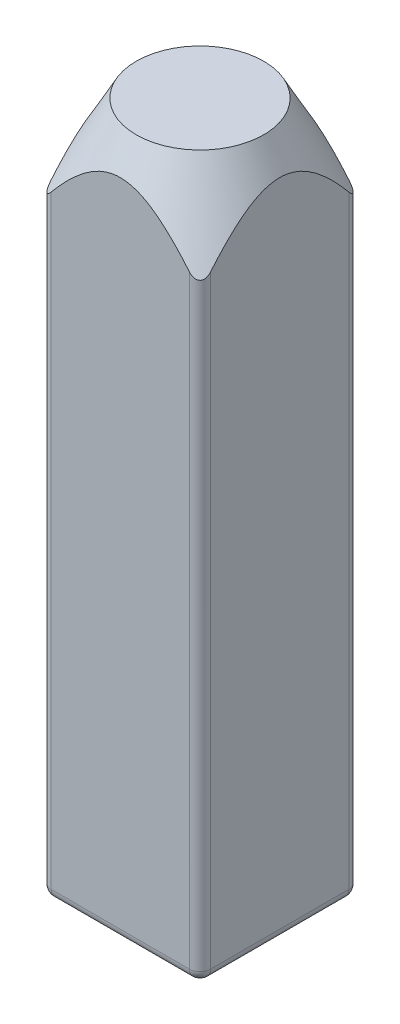
from build123d import *

# Parameters (mm, degrees)
SKETCH1_W           = 15
SKETCH1_H           = 15
BOSS_EXTRUDE1_DEPTH = 65
FILLET1_R           = 1
FILLET2_R           = 1


with BuildPart() as part:
    # Sketch1 → Boss-Extrude1 (new body)
    with BuildSketch(Plane(origin=(0, 0, 0), x_dir=(1, 0, 0), z_dir=(0, 1, 0))):
        Rectangle(SKETCH1_W, SKETCH1_H)
    extrude(amount=BOSS_EXTRUDE1_DEPTH)

    # Sketch2 → Cut-Revolve4 (revolve, cut)
    with BuildSketch(Plane.XY):
        Polygon((6, 65), (10.984781161, 55.903414997), (10.984781161, 65), align=None)
    revolve(axis=Axis((0, 73.5, 0), (0, -1, 0)), mode=Mode.SUBTRACT)

    # Fillet1
    fillet1_edges = [part.edges().sort_by_distance(p)[0] for p in [
        (-7.5, 28.29677194, -7.5),
        (7.5, 28.29677194, -7.5),
        (7.5, 28.29677194, 7.5),
        (-7.5, 28.29677194, 7.5),
    ]]
    fillet(fillet1_edges, radius=FILLET1_R)

    # Fillet2
    fillet2_edges = [part.edges().sort_by_distance(p)[0] for p in [
        (-7.207106781, 0, 7.207106781),
        (-7.5, 0, 0),
        (-7.207106781, 0, -7.207106781),
        (0, 0, -7.5),
        (7.207106781, 0, -7.207106781),
        (7.5, 0, 0),
        (7.207106781, 0, 7.207106781),
        (0, 0, 7.5),
    ]]
    fillet(fillet2_edges, radius=FILLET2_R)


solid = part.part
